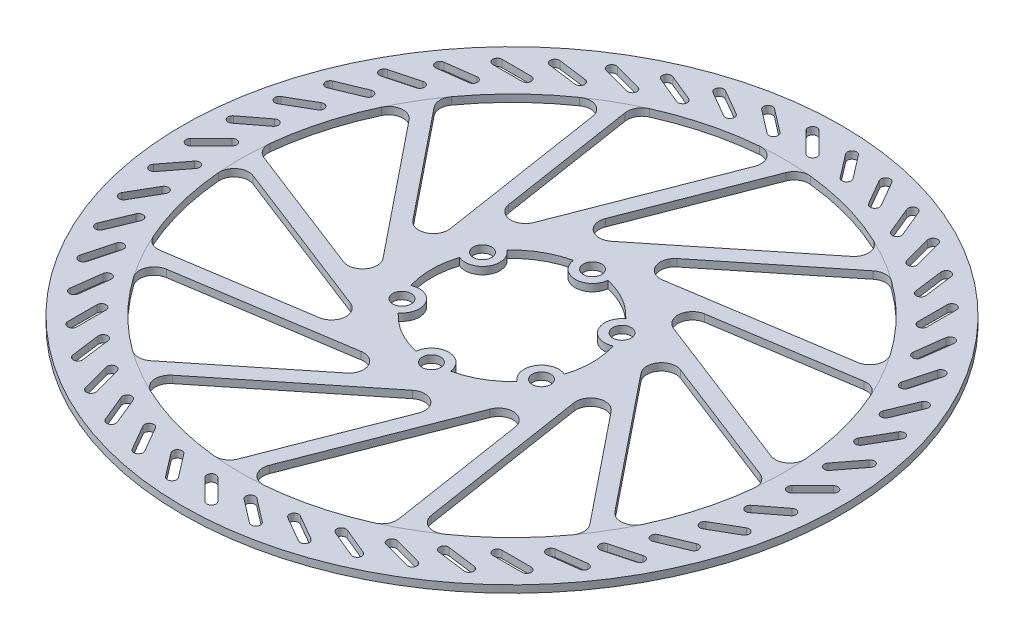
from build123d import *

# Parameters (mm, degrees)
SKETCH1_R                = 90
SKETCH1_R_2              = 2.5
BOSS_EXTRUDE1_DEPTH      = 2
CUT_EXTRUDE1_DEPTH       = 2
CUT_EXTRUDE2_DEPTH       = 2
FILLET1_R                = 4
CIRPATTERN1_COUNT        = 12
FILLET1_OF_CIRPATTERN1_R = 4
CUT_EXTRUDE3_DEPTH       = 2
CIRPATTERN2_COUNT        = 48
CUT_EXTRUDE5_DEPTH       = 0.1
CIRPATTERN3_COUNT        = 6


with BuildPart() as part:
    # Sketch1 → Boss-Extrude1 (new body)
    with BuildSketch(Plane(origin=(0, 0, 0), x_dir=(1, 0, 0), z_dir=(0, 1, 0))):
        Circle(SKETCH1_R)
        with Locations((0, 22)):
            Circle(SKETCH1_R_2, mode=Mode.SUBTRACT)
        with Locations((19.052558883, 11)):
            Circle(SKETCH1_R_2, mode=Mode.SUBTRACT)
        with Locations((19.052558883, -11)):
            Circle(SKETCH1_R_2, mode=Mode.SUBTRACT)
        with Locations((0, -22)):
            Circle(SKETCH1_R_2, mode=Mode.SUBTRACT)
        with Locations((-19.052558883, -11)):
            Circle(SKETCH1_R_2, mode=Mode.SUBTRACT)
        with Locations((-19.052558883, 11)):
            Circle(SKETCH1_R_2, mode=Mode.SUBTRACT)
    extrude(amount=BOSS_EXTRUDE1_DEPTH)

    # Sketch2 → Cut-Extrude1 (cut)
    with BuildSketch(Plane(origin=(0, 2, 0), x_dir=(1, 0, 0), z_dir=(0, 1, 0))):
        with BuildLine():
            ThreePointArc((-4.722240197, 21.487215909), (0, 17.25), (4.722240197, 21.487215909))
            ThreePointArc((4.722240197, 21.487215909), (11, 19.052558883), (16.247354735, 14.833187928))
            ThreePointArc((16.247354735, 14.833187928), (14.938938215, 8.625), (20.969594932, 6.654027981))
            ThreePointArc((20.969594932, 6.654027981), (21.999999721, 0), (20.969594932, -6.654027981))
            ThreePointArc((20.969594932, -6.654027981), (14.938938215, -8.625), (16.247354735, -14.833187928))
            ThreePointArc((16.247354735, -14.833187928), (11, -19.052558883), (4.722240197, -21.487215909))
            ThreePointArc((4.722240197, -21.487215909), (0, -17.25), (-4.722240197, -21.487215909))
            ThreePointArc((-4.722240197, -21.487215909), (-11, -19.052558883), (-16.247354735, -14.833187928))
            ThreePointArc((-16.247354735, -14.833187928), (-14.938938215, -8.625), (-20.969594932, -6.654027981))
            ThreePointArc((-20.969594932, -6.654027981), (-22, 0), (-20.969594932, 6.654027981))
            ThreePointArc((-20.969594932, 6.654027981), (-14.938938215, 8.625), (-16.247354735, 14.833187928))
            ThreePointArc((-16.247354735, 14.833187928), (-11, 19.052558883), (-4.722240197, 21.487215909))
        make_face()
    extrude(amount=-CUT_EXTRUDE1_DEPTH, mode=Mode.SUBTRACT)

    # Sketch3 → Cut-Extrude2 (cut)
    with BuildSketch(Plane(origin=(0, 2, 0), x_dir=(1, 0, 0), z_dir=(0, 1, 0))):
        with BuildLine():
            Line((0, -74.2), (24.470546825, -11.111163894))
            Line((24.470546825, -11.111163894), (33.035898327, -66.439968556))
            ThreePointArc((33.035898327, -66.439968556), (16.967532719, -72.23394516), (0, -74.2))
        make_face()
    cut_extrude2 = extrude(amount=-CUT_EXTRUDE2_DEPTH, mode=Mode.SUBTRACT)

    # Fillet1
    fillet1_edges = [part.edges().sort_by_distance(p)[0] for p in [
        (0, 1, 74.2),
        (24.470546825, 1, 11.111163894),
        (33.035898327, 1, 66.439968556),
    ]]
    fillet(fillet1_edges, radius=FILLET1_R)

    # CirPattern1: Cut-Extrude2 ×12 about axis
    cirpattern1_axis = Axis((0, 2, 0), (0, -1, 0))
    for i in range(1, CIRPATTERN1_COUNT):
        add(cut_extrude2.rotate(cirpattern1_axis, i * 360 / CIRPATTERN1_COUNT), mode=Mode.SUBTRACT)

    # Fillet1 of CirPattern1
    fillet1_of_cirpattern1_edges = [part.edges().sort_by_distance(p)[0] for p in [
        (-37.1, 1, 64.259084961),
        (15.636533248, 1, 21.857823611),
        (-4.610057089, 1, 74.05664976),
        (-64.259084961, 1, 37.1),
        (2.612723215, 1, 26.747697142),
        (-41.020751432, 1, 61.829911466),
        (-74.2, 1, 0),
        (-11.111163894, 1, 24.470546825),
        (-66.439968556, 1, 33.035898327),
        (-64.259084961, 1, -37.1),
        (-21.857823611, 1, 15.636533248),
        (-74.05664976, 1, -4.610057089),
        (-37.1, 1, -64.259084961),
        (-26.747697142, 1, 2.612723215),
        (-61.829911466, 1, -41.020751432),
        (0, 1, -74.2),
        (-24.470546825, 1, -11.111163894),
        (-33.035898327, 1, -66.439968556),
        (37.1, 1, -64.259084961),
        (-15.636533248, 1, -21.857823611),
        (4.610057089, 1, -74.05664976),
        (64.259084961, 1, -37.1),
        (-2.612723215, 1, -26.747697142),
        (41.020751432, 1, -61.829911466),
        (74.2, 1, 0),
        (11.111163894, 1, -24.470546825),
        (66.439968556, 1, -33.035898327),
        (64.259084961, 1, 37.1),
        (21.857823611, 1, -15.636533248),
        (74.05664976, 1, 4.610057089),
        (37.1, 1, 64.259084961),
        (26.747697142, 1, -2.612723215),
        (61.829911466, 1, 41.020751432),
    ]]
    fillet(fillet1_of_cirpattern1_edges, radius=FILLET1_OF_CIRPATTERN1_R)

    # Sketch4 → Cut-Extrude3 (cut)
    with BuildSketch(Plane(origin=(0, 2, 0), x_dir=(1, 0, 0), z_dir=(0, 1, 0))):
        with BuildLine():
            Line((1.944543648, -85.812310601), (-3.712310601, -80.155456352))
            ThreePointArc((-3.712310601, -80.155456352), (-3.712310601, -78.387689399), (-1.944543648, -78.387689399))
            Line((-1.944543648, -78.387689399), (3.712310601, -84.044543648))
            ThreePointArc((3.712310601, -84.044543648), (3.712310601, -85.812310601), (1.944543648, -85.812310601))
        make_face()
    cut_extrude3 = extrude(amount=-CUT_EXTRUDE3_DEPTH, mode=Mode.SUBTRACT)

    # CirPattern2: Cut-Extrude3 ×48 about axis
    cirpattern2_axis = Axis((0, 2, 0), (0, -1, 0))
    for i in range(1, CIRPATTERN2_COUNT):
        add(cut_extrude3.rotate(cirpattern2_axis, i * 360 / CIRPATTERN2_COUNT), mode=Mode.SUBTRACT)

    # Sketch6 → Cut-Extrude5 (cut)
    with BuildSketch(Plane(origin=(0, 0, 0), x_dir=(1, 0, 0), z_dir=(0, 1, 0))):
        with BuildLine():
            Line((13.538072264, 20.719096887), (13.385227713, 20.811644964))
            add(Edge.make_bspline(
                [(13.385227713, 20.811644964), (13.447138503, 20.851034412), (13.569941796, 20.929165442), (13.761724102, 21.031131647), (13.956288315, 21.12163633), (14.089514765, 21.171678003), (14.155760565, 21.19656083)],
                knots=[0, 0, 0, 0, 1.019616595, 2.022462878, 3.016685275, 4, 4, 4, 4], degree=3))
            Line((14.155760565, 21.19656083), (10.940416014, 23.143576054))
            Line((10.940416014, 23.143576054), (11.06381345, 23.346901375))
            Line((11.06381345, 23.346901375), (14.279158001, 21.39988615))
            add(Edge.make_bspline(
                [(14.279158001, 21.39988615), (14.272732907, 21.428330113), (14.259431155, 21.487217108), (14.245812152, 21.579521968), (14.23688383, 21.678306059), (14.232094536, 21.783345276), (14.231562302, 21.894902458), (14.234983663, 22.012780566), (14.2435946, 22.136930053), (14.25227114, 22.221623631), (14.256722104, 22.265070445)],
                knots=[0, 0, 0, 0, 0.804535894, 1.665615324, 2.572460149, 3.540970511, 4.566495723, 5.650527886, 6.794748319, 8, 8, 8, 8], degree=3))
            Line((14.256722104, 22.265070445), (14.414474508, 22.169717881))
            add(Edge.make_bspline(
                [(14.414474508, 22.169717881), (14.426420569, 22.106295056), (14.449647684, 21.982979994), (14.490801787, 21.804617067), (14.537480935, 21.638322528), (14.586587951, 21.482823726), (14.641460515, 21.339341746), (14.6992289, 21.206885891), (14.762089862, 21.086299337), (14.809383609, 21.012322026), (14.832343097, 20.976408586)],
                knots=[0, 0, 0, 0, 1.216822473, 2.365907522, 3.450020883, 4.472911399, 5.439452803, 6.345046235, 7.196576856, 8, 8, 8, 8], degree=3))
            Line((14.832343097, 20.976408586), (14.777655597, 20.885963875))
            add(Edge.make_bspline(
                [(14.777655597, 20.885963875), (14.738918819, 20.891044026), (14.657964163, 20.901660859), (14.530087305, 20.905157971), (14.391461976, 20.898302008), (14.241897985, 20.881905517), (14.081305715, 20.85535366), (13.909471577, 20.820512449), (13.726939111, 20.774519122), (13.602454319, 20.737989549), (13.538072264, 20.719096887)],
                knots=[0, 0, 0, 0, 0.743531713, 1.553881244, 2.431455946, 3.384827093, 4.41710497, 5.529840547, 6.722462889, 8, 8, 8, 8], degree=3))
        make_face()
    cut_extrude5 = extrude(amount=CUT_EXTRUDE5_DEPTH, mode=Mode.SUBTRACT)

    # CirPattern3: Cut-Extrude5 ×6 about axis
    cirpattern3_axis = Axis((0, 2, 0), (0, -1, 0))
    for i in range(1, CIRPATTERN3_COUNT):
        add(cut_extrude5.rotate(cirpattern3_axis, i * 360 / CIRPATTERN3_COUNT), mode=Mode.SUBTRACT)


solid = part.part
